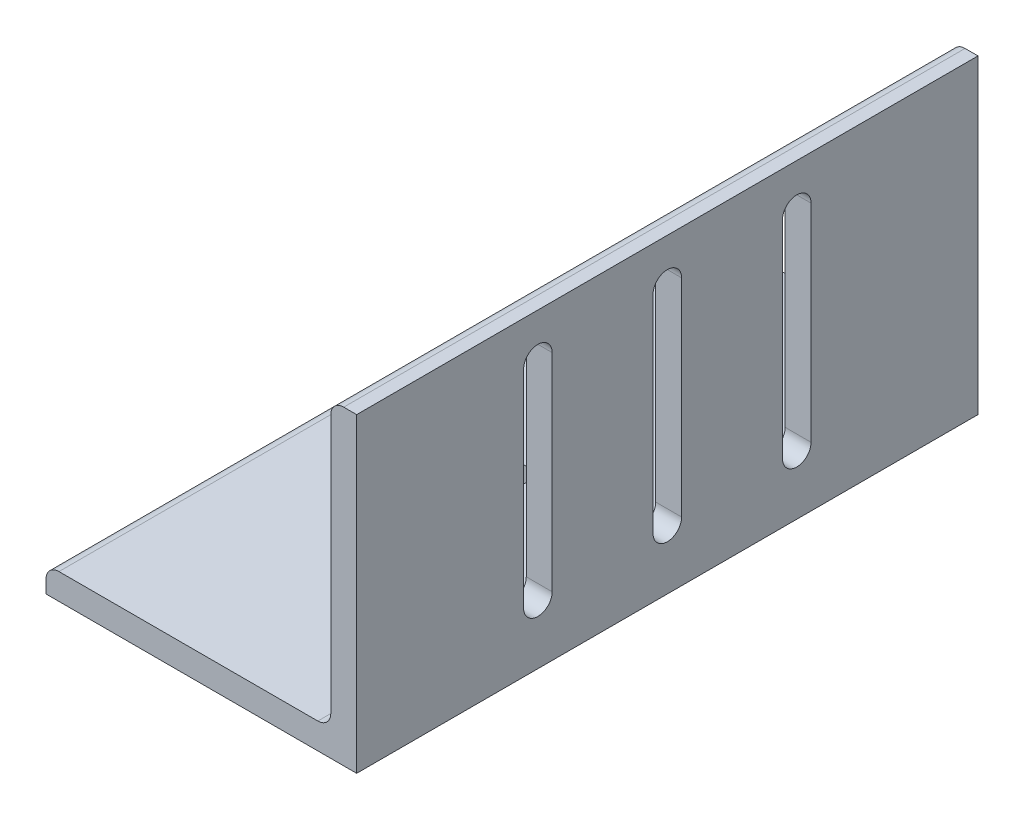
from build123d import *

# Parameters (mm, degrees)
BOSS_EXTRUDE1_DEPTH = 76.2
CUT_EXTRUDE1_DEPTH  = 10
SKETCH4_R           = 3.5
CUT_EXTRUDE2_DEPTH  = 10


with BuildPart() as part:
    # Sketch2 → Boss-Extrude1 (new, symmetric)
    with BuildSketch(Plane.XY):
        with BuildLine():
            Line((-38.1, 0), (38.1, 0))
            Line((38.1, 0), (38.1, 76.2))
            Line((38.1, 76.2), (34.925, 76.2))
            ThreePointArc((34.925, 76.2), (32.67993597, 75.27006403), (31.75, 73.025))
            Line((31.75, 73.025), (31.75, 9.525))
            ThreePointArc((31.75, 9.525), (30.82006403, 7.27993597), (28.575, 6.35))
            Line((28.575, 6.35), (-34.925, 6.35))
            ThreePointArc((-34.925, 6.35), (-37.17006403, 5.42006403), (-38.1, 3.175))
            Line((-38.1, 3.175), (-38.1, 0))
        make_face()
    extrude(amount=BOSS_EXTRUDE1_DEPTH, both=True)

    # Sketch3 → Cut-Extrude1 (cut)
    with BuildSketch(Plane(origin=(38.1, 0, 0), x_dir=(0, 0, -1), z_dir=(1, 0, 0))):
        with BuildLine():
            Line((-28.25, 65.4), (-28.25, 14.6))
            ThreePointArc((-28.25, 14.6), (-31.75, 11.1), (-35.25, 14.6))
            Line((-35.25, 14.6), (-35.25, 65.4))
            ThreePointArc((-35.25, 65.4), (-31.75, 68.9), (-28.25, 65.4))
        make_face()
        with BuildLine():
            Line((28.25, 65.4), (28.25, 14.6))
            ThreePointArc((28.25, 14.6), (31.75, 11.1), (35.25, 14.6))
            Line((35.25, 14.6), (35.25, 65.4))
            ThreePointArc((35.25, 65.4), (31.75, 68.9), (28.25, 65.4))
        make_face()
        with BuildLine():
            Line((3.5, 65.4), (3.5, 14.6))
            ThreePointArc((3.5, 14.6), (0, 11.1), (-3.5, 14.6))
            Line((-3.5, 14.6), (-3.5, 65.4))
            ThreePointArc((-3.5, 65.4), (0, 68.9), (3.5, 65.4))
        make_face()
    extrude(amount=-CUT_EXTRUDE1_DEPTH, mode=Mode.SUBTRACT)

    # Sketch4 → Cut-Extrude2 (cut)
    with BuildSketch(Plane.XZ):
        with Locations((0, 25.4)):
            Circle(SKETCH4_R)
        with Locations((0, -25.4)):
            Circle(SKETCH4_R)
        Circle(SKETCH4_R)
    extrude(amount=-CUT_EXTRUDE2_DEPTH, mode=Mode.SUBTRACT)


solid = part.part
